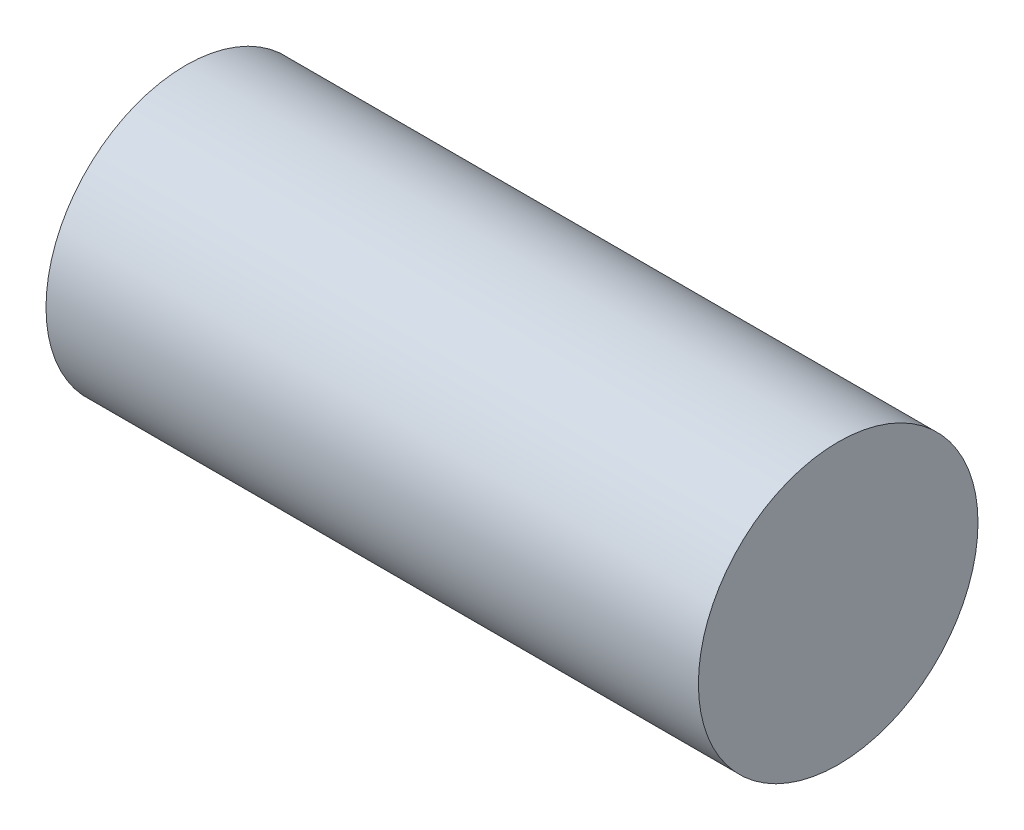
from build123d import *

# Parameters (mm, degrees)
SKETCH1_R           = 38.1
BOSS_EXTRUDE1_DEPTH = 177.8


with BuildPart() as part:
    # Sketch1 → Boss-Extrude1 (new body)
    with BuildSketch(Plane(origin=(0, 0, 0), x_dir=(0, 0, -1), z_dir=(1, 0, 0))):
        Circle(SKETCH1_R)
    extrude(amount=BOSS_EXTRUDE1_DEPTH)


solid = part.part
